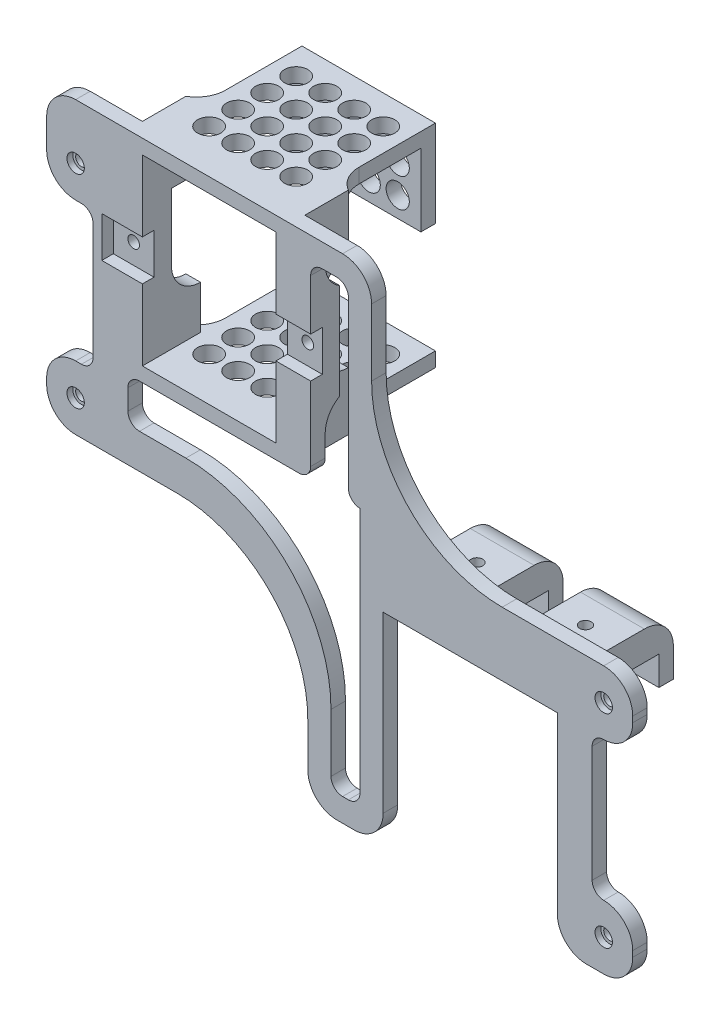
from build123d import *

# Parameters (mm, degrees)
SKICA1_W                       = 202
SKICA1_H                       = 202
P_IDAT_VYSUNUT_M1_DEPTH        = 5
ODEBRAT_VYSUNUT_M1_DEPTH       = 10
SKICA3_R                       = 2
ODEBRAT_VYSUNUT_M2_DEPTH       = 143.923056223
SKICA4_R                       = 3
ODEBRAT_VYSUNUT_M4_DEPTH       = 2
SKICA6_W                       = 60
SKICA6_H                       = 90
ODEBRAT_VYSUNUT_M5_DEPTH       = 10
SKICA7_W                       = 60
SKICA7_H                       = 10
P_IDAT_VYSUNUT_M2_DEPTH        = 35
SKICA8_W                       = 60
SKICA8_H                       = 5
P_IDAT_VYSUNUT_M3_DEPTH        = 10
SKICA9_R                       = 2
ODEBRAT_VYSUNUT_M6_DEPTH       = 10
ZAOBLIT1_R                     = 8
SKICA11_W                      = 46
SKICA11_H                      = 63
ODEBRAT_VYSUNUT_M8_DEPTH       = 10
SKICA19_W                      = 12
SKICA19_H                      = 33
P_IDAT_VYSUNUT_M7_DEPTH        = 5
SKICA13_W                      = 14
SKICA13_H                      = 14
ODEBRAT_VYSUNUT_M9_DEPTH       = 4
SKICA14_R                      = 2
ODEBRAT_VYSUNUT_M10_DEPTH      = 5
SKICA15_W                      = 46
SKICA15_H                      = 5
P_IDAT_VYSUNUT_M4_DEPTH        = 50
SKICA16_W                      = 46
SKICA16_H                      = 5
P_IDAT_VYSUNUT_M5_DEPTH        = 25
SKICA17_W                      = 5
SKICA17_H                      = 20
P_IDAT_VYSUNUT_M6_DEPTH        = 15
ZAOBLIT2_R                     = 10
SKICA21_W                      = 112
SKICA21_H                      = 20
SKICA21_H_2                    = 12
ODEBRAT_VYSUNUT_M15_DEPTH      = 154.058812226
SKICA22_W                      = 14
SKICA22_H                      = 48
SKICA22_W_2                    = 16
ODEBRAT_VYSUNUT_M16_DEPTH      = 146.420081144
ODEBRAT_VYSUNUT_M17_DEPTH      = 144.603621124
ODEBRAT_VYSUNUT_M18_DEPTH      = 145.225517853
ODEBRAT_VYSUNUT_M18_DEPTH_BACK = 145.225517853
SKICA24_W                      = 16
SKICA24_H                      = 27
ZAOBLIT3_R                     = 10
ZAOBLIT4_R                     = 4
ODEBRAT_VYSUNUT_M19_DEPTH      = 149.694317309
ODEBRAT_VYSUNUT_M19_DEPTH_BACK = 149.694317309
SKICA25_R                      = 4
ODEBRAT_VYSUNUT_M20_DEPTH      = 144.603621159
ODEBRAT_VYSUNUT_M20_DEPTH_BACK = 144.603621159
SKICA26_R                      = 4


# Some blends are built 0.0001 mm under size
with BuildPart() as part:
    # Skica1 → Přidat vysunutím1 (new body)
    with BuildSketch(Plane.XY):
        Rectangle(SKICA1_W, SKICA1_H)
    extrude(amount=P_IDAT_VYSUNUT_M1_DEPTH)

    # Skica2 → Odebrat vysunutím1 (cut)
    with BuildSketch(Plane.XY.offset(5)):
        with BuildLine():
            Line((11, 56), (11, 101))
            Line((11, 101), (101, 101))
            Line((101, 101), (101, 11))
            Line((101, 11), (56, 11))
            ThreePointArc((56, 11), (24.180194847, 24.180194847), (11, 56))
        make_face()
        with BuildLine():
            Line((-56, -11), (-101, -11))
            Line((-101, -11), (-101, -101))
            Line((-101, -101), (-11, -101))
            Line((-11, -101), (-11, -56))
            ThreePointArc((-11, -56), (-24.180194847, -24.180194847), (-56, -11))
        make_face()
    extrude(amount=-ODEBRAT_VYSUNUT_M1_DEPTH, mode=Mode.SUBTRACT)

    # Skica3 → Odebrat vysunutím2 (cut, through all)
    with BuildSketch(Plane.XY.offset(5)):
        with Locations((91, 0)):
            Circle(SKICA3_R)
        with Locations(Location((-91, 0, 0), (0, 0, 180))):
            Circle(SKICA3_R)
        with Locations((91, -70)):
            Circle(SKICA3_R)
        with Locations(Location((-91, 70, 0), (0, 0, 180))):
            Circle(SKICA3_R)
    extrude(amount=-ODEBRAT_VYSUNUT_M2_DEPTH, mode=Mode.SUBTRACT)

    # Skica4 → Odebrat vysunutím4 (cut)
    with BuildSketch(Plane.XY.offset(5)):
        with Locations((91, 0)):
            Circle(SKICA4_R)
        with Locations(Location((-91, 0, 0), (0, 0, 180))):
            Circle(SKICA4_R)
        with Locations((91, -70)):
            Circle(SKICA4_R)
        with Locations(Location((-91, 70, 0), (0, 0, 180))):
            Circle(SKICA4_R)
    extrude(amount=-ODEBRAT_VYSUNUT_M4_DEPTH, mode=Mode.SUBTRACT)

    # Skica6 → Odebrat vysunutím5 (cut)
    with BuildSketch(Plane.XY.offset(5)):
        with Locations((45, -56)):
            Rectangle(SKICA6_W, SKICA6_H)
    extrude(amount=-ODEBRAT_VYSUNUT_M5_DEPTH, mode=Mode.SUBTRACT)

    # Skica7 → Přidat vysunutím2 (add)
    with BuildSketch(Plane(origin=(0, 0, 0), x_dir=(-1, 0, 0), z_dir=(0, 0, -1))):
        with Locations((-45, -6)):
            Rectangle(SKICA7_W, SKICA7_H)
    extrude(amount=P_IDAT_VYSUNUT_M2_DEPTH)

    # Skica8 → Přidat vysunutím3 (add)
    with BuildSketch(Plane.XZ.offset(11)):
        with Locations((45, -32.5)):
            Rectangle(SKICA8_W, SKICA8_H)
    extrude(amount=P_IDAT_VYSUNUT_M3_DEPTH)

    # Skica9 → Odebrat vysunutím6 (cut)
    with BuildSketch(Plane.XZ.offset(11)):
        with Locations(Location((26.3, -16, 0), (0, 0, 270))):
            Circle(SKICA9_R)
        with Locations(Location((63.7, -16, 0), (0, 0, 90))):
            Circle(SKICA9_R)
    extrude(amount=-ODEBRAT_VYSUNUT_M6_DEPTH, mode=Mode.SUBTRACT)

    # Zaoblit1
    zaoblit1_edges = [part.edges().sort_by_distance(p)[0] for p in [
        (15, -6, 0),
        (45, -1, 0),
    ]]
    fillet(zaoblit1_edges, radius=ZAOBLIT1_R)

    # Skica11 → Odebrat vysunutím8 (cut)
    with BuildSketch(Plane.XY.offset(5)):
        with Locations((-45, 52.5)):
            Rectangle(SKICA11_W, SKICA11_H)
    extrude(amount=-ODEBRAT_VYSUNUT_M8_DEPTH, mode=Mode.SUBTRACT)

    # Skica19 → Přidat vysunutím7 (add)
    with BuildSketch(Plane(origin=(0, 0, 0), x_dir=(-1, 0, 0), z_dir=(0, 0, -1))):
        with Locations((74, 52.5)):
            Rectangle(SKICA19_W, SKICA19_H)
        with Locations((16, 52.5)):
            Rectangle(SKICA19_W, SKICA19_H)
    extrude(amount=P_IDAT_VYSUNUT_M7_DEPTH)

    # Skica13 → Odebrat vysunutím9 (cut)
    with BuildSketch(Plane.XY.offset(5)):
        with Locations((-75, 52.5)):
            Rectangle(SKICA13_W, SKICA13_H)
        with Locations((-15, 52.5)):
            Rectangle(SKICA13_W, SKICA13_H)
    extrude(amount=-ODEBRAT_VYSUNUT_M9_DEPTH, mode=Mode.SUBTRACT)

    # Skica14 → Odebrat vysunutím10 (cut)
    with BuildSketch(Plane.XY.offset(1)):
        with Locations((-75, 52.5)):
            Circle(SKICA14_R)
        with Locations(Location((-15, 52.5, 0), (0, 0, 180))):
            Circle(SKICA14_R)
    extrude(amount=-ODEBRAT_VYSUNUT_M10_DEPTH, mode=Mode.SUBTRACT)

    # Skica15 → Přidat vysunutím4 (add)
    with BuildSketch(Plane(origin=(0, 0, 0), x_dir=(-1, 0, 0), z_dir=(0, 0, -1))):
        with Locations((45, 86.5)):
            Rectangle(SKICA15_W, SKICA15_H)
        with Locations((45, 18.5)):
            Rectangle(SKICA15_W, SKICA15_H)
    extrude(amount=P_IDAT_VYSUNUT_M4_DEPTH)

    # Skica16 → Přidat vysunutím5 (add)
    with BuildSketch(Plane.XZ.offset(-84)):
        with Locations((-45, -47.5)):
            Rectangle(SKICA16_W, SKICA16_H)
    extrude(amount=P_IDAT_VYSUNUT_M5_DEPTH)

    # Skica17 → Přidat vysunutím6 (add)
    with BuildSketch(Plane(origin=(0, 0, 0), x_dir=(-1, 0, 0), z_dir=(0, 0, -1))):
        with Locations((70.5, 26)):
            Rectangle(SKICA17_W, SKICA17_H)
        with Locations((19.5, 79)):
            Rectangle(SKICA17_W, SKICA17_H)
        with Locations((70.5, 79)):
            Rectangle(SKICA17_W, SKICA17_H)
        with Locations((19.5, 26)):
            Rectangle(SKICA17_W, SKICA17_H)
    extrude(amount=P_IDAT_VYSUNUT_M6_DEPTH)

    # Zaoblit2
    # the kernel refuses this fillet: 10 mm, written as the material it adds along each edge
    with BuildSketch(Plane(origin=(-22, 84, -15), x_dir=(1, 0, 0), z_dir=(0, 1, 0)), Plane(origin=(-68, 21, -15), x_dir=(-1, 0, 0), z_dir=(0, -1, 0))) as zaoblit2_piece_1:
        with BuildLine():
            CenterArc((10, 8.660254038), ZAOBLIT2_R, 180, 60)
            Line((0, 8.660254038), (0, 0))
            Line((0, 0), (5, 0))
        make_face()
    extrude(amount=5)
    with BuildSketch(Plane(origin=(-68, 84, -15), x_dir=(0, 0, -1), z_dir=(0, 1, 0)), Plane(origin=(-22, 21, -15), x_dir=(0, 0, -1), z_dir=(0, -1, 0))) as zaoblit2_piece_2:
        with BuildLine():
            CenterArc((8.660254038, 10), ZAOBLIT2_R, 210, 60)
            Line((0, 5), (0, 0))
            Line((0, 0), (8.660254038, 0))
        make_face()
    extrude(amount=5)
    with BuildSketch(Plane(origin=(-10, 69, 0), x_dir=(0, 1, 0), z_dir=(-1, 0, 0)), Plane(origin=(-17, 36, 0), x_dir=(0, -1, 0), z_dir=(1, 0, 0))) as zaoblit2_piece_3:
        with BuildLine():
            CenterArc((8.660254038, 10), ZAOBLIT2_R, 210, 60)
            Line((0, 5), (0, 0))
            Line((0, 0), (8.660254038, 0))
        make_face()
    extrude(amount=7)
    with BuildSketch(Plane(origin=(-80, 69, 0), x_dir=(0, 1, 0), z_dir=(1, 0, 0)), Plane(origin=(-73, 36, 0), x_dir=(0, -1, 0), z_dir=(-1, 0, 0))) as zaoblit2_piece_4:
        with BuildLine():
            CenterArc((8.660254038, -10), ZAOBLIT2_R, 90, 60)
            Line((0, -5), (0, 0))
            Line((0, 0), (8.660254038, 0))
        make_face()
    extrude(amount=7)
    with BuildSketch(Plane(origin=(-68, 36, -5), x_dir=(0, 0, -1), z_dir=(-1, 0, 0)), Plane(origin=(-17, 69, -5), x_dir=(0, -1, 0), z_dir=(-1, 0, 0))) as zaoblit2_piece_5:
        with BuildLine():
            CenterArc((ZAOBLIT2_R, -ZAOBLIT2_R), ZAOBLIT2_R, 90, 90)
            Line((0, -ZAOBLIT2_R), (0, 0))
            Line((0, 0), (ZAOBLIT2_R, 0))
        make_face()
    extrude(amount=5)
    with BuildSketch(Plane(origin=(-22, 36, -5), x_dir=(0, 0, -1), z_dir=(1, 0, 0))) as zaoblit2_piece_6:
        with BuildLine():
            CenterArc((ZAOBLIT2_R, ZAOBLIT2_R), ZAOBLIT2_R, 180, 90)
            Line((0, ZAOBLIT2_R), (0, 0))
            Line((0, 0), (ZAOBLIT2_R, 0))
        make_face()
    extrude(amount=5)

    # Skica21 → Odebrat vysunutím15 (cut, through all)
    with BuildSketch(Plane.XY.offset(5)):
        with Locations((45, -91)):
            Rectangle(SKICA21_W, SKICA21_H)
        with Locations((-45, 95)):
            Rectangle(SKICA21_W, SKICA21_H_2)
    extrude(amount=-ODEBRAT_VYSUNUT_M15_DEPTH, mode=Mode.SUBTRACT)

    # Skica22 → Odebrat vysunutím16 (cut, through all)
    with BuildSketch(Plane.XY.offset(5)):
        with Locations((94, -35)):
            Rectangle(SKICA22_W, SKICA22_H)
        with Locations((-93, 35)):
            Rectangle(SKICA22_W_2, SKICA22_H)
    extrude(amount=-ODEBRAT_VYSUNUT_M16_DEPTH, mode=Mode.SUBTRACT)

    # Skica23 → Odebrat vysunutím17 (cut, through all)
    with BuildSketch(Plane(origin=(0, 0, 0), x_dir=(-1, 0, 0), z_dir=(0, 0, -1))):
        with BuildLine():
            Line((73, 16), (10, 16))
            Line((10, 16), (10, 81))
            Line((10, 81), (-3, 81))
            Line((-3, 81), (-3, 16))
            Line((-3, 16), (-7, 16))
            Line((-7, 16), (-7, -28.5))
            Line((-7, -28.5), (-7, -73))
            Line((-7, -73), (3, -73))
            Line((3, -73), (3, -49))
            ThreePointArc((3, -49), (17.644660941, -13.644660941), (53, 1))
            Line((53, 1), (73, 1))
            Line((73, 1), (73, 16))
        make_face()
    extrude(amount=-ODEBRAT_VYSUNUT_M17_DEPTH, mode=Mode.SUBTRACT)

    # Skica24 → Odebrat vysunutím18 (cut, two sides: drawn at the far end of the back side and taken through both)
    with BuildSketch(Plane(origin=(0, -1, 0), x_dir=(1, 0, 0), z_dir=(0, 1, 0)).offset(-ODEBRAT_VYSUNUT_M18_DEPTH_BACK)):
        with Locations((45, 21.5)):
            Rectangle(SKICA24_W, SKICA24_H)
    extrude(amount=ODEBRAT_VYSUNUT_M18_DEPTH + ODEBRAT_VYSUNUT_M18_DEPTH_BACK, mode=Mode.SUBTRACT)

    # Zaoblit3
    zaoblit3_edges = [part.edges().sort_by_distance(p)[0] for p in [
        (26, -1, -35),
        (101, 11, 2.5),
        (-101, -11, 2.5),
        (75, -81, 2.5),
        (101, -81, 2.5),
        (15, -81, 2.5),
        (-11, -81, 2.5),
        (-101, 89, 2.5),
        (11, 89, 2.5),
        (101, -11, 2.5),
        (101, -59, 2.5),
        (-101, 11, 2.5),
        (-101, 59, 2.5),
        (64, -1, -35),
    ]]
    fillet(zaoblit3_edges, radius=ZAOBLIT3_R)

    # Zaoblit4
    zaoblit4_edges = [part.edges().sort_by_distance(p)[0] for p in [
        (87, -59, 2.5),
        (87, -11, 2.5),
        (-85, 11, 2.5),
        (-85, 59, 2.5),
        (3, 81, 2.5),
        (-10, 81, 2.5),
        (3, 16, 2.5),
        (-10, 16, 2.5),
        (-73, 16, 2.5),
        (-73, 1, 2.5),
        (7, -73, 2.5),
        (-3, -73, 2.5),
    ]]
    fillet(zaoblit4_edges, radius=ZAOBLIT4_R - 0.0001)  # a hair under: the kernel refuses the full size

    # Skica25 → Odebrat vysunutím19 (cut, two sides: drawn at the far end of the back side and taken through both)
    with BuildSketch(Plane.XZ.offset(-16).offset(-ODEBRAT_VYSUNUT_M19_DEPTH_BACK)):
        with Locations((-60, -10)):
            Circle(SKICA25_R)
        with Locations((-50, -10)):
            Circle(SKICA25_R)
        with Locations((-40, -10)):
            Circle(SKICA25_R)
        with Locations((-30, -10)):
            Circle(SKICA25_R)
        with Locations((-50, -20)):
            Circle(SKICA25_R)
        with Locations((-40, -20)):
            Circle(SKICA25_R)
        with Locations((-30, -20)):
            Circle(SKICA25_R)
        with Locations((-50, -30)):
            Circle(SKICA25_R)
        with Locations((-40, -30)):
            Circle(SKICA25_R)
        with Locations((-30, -30)):
            Circle(SKICA25_R)
        with Locations((-50, -40)):
            Circle(SKICA25_R)
        with Locations((-40, -40)):
            Circle(SKICA25_R)
        with Locations((-30, -40)):
            Circle(SKICA25_R)
        with Locations((-60, -20)):
            Circle(SKICA25_R)
        with Locations((-60, -30)):
            Circle(SKICA25_R)
        with Locations((-60, -40)):
            Circle(SKICA25_R)
    extrude(amount=ODEBRAT_VYSUNUT_M19_DEPTH + ODEBRAT_VYSUNUT_M19_DEPTH_BACK, mode=Mode.SUBTRACT)

    # Skica26 → Odebrat vysunutím20 (cut, two sides: drawn at the far end of the back side and taken through both)
    with BuildSketch(Plane.XY.offset(-45).offset(-ODEBRAT_VYSUNUT_M20_DEPTH_BACK)):
        with Locations((-60, 76)):
            Circle(SKICA26_R)
        with Locations((-50, 76)):
            Circle(SKICA26_R)
        with Locations((-40, 76)):
            Circle(SKICA26_R)
        with Locations((-30, 76)):
            Circle(SKICA26_R)
        with Locations((-50, 66)):
            Circle(SKICA26_R)
        with Locations((-40, 66)):
            Circle(SKICA26_R)
        with Locations((-30, 66)):
            Circle(SKICA26_R)
        with Locations((-60, 66)):
            Circle(SKICA26_R)
    extrude(amount=ODEBRAT_VYSUNUT_M20_DEPTH + ODEBRAT_VYSUNUT_M20_DEPTH_BACK, mode=Mode.SUBTRACT)


solid = part.part
